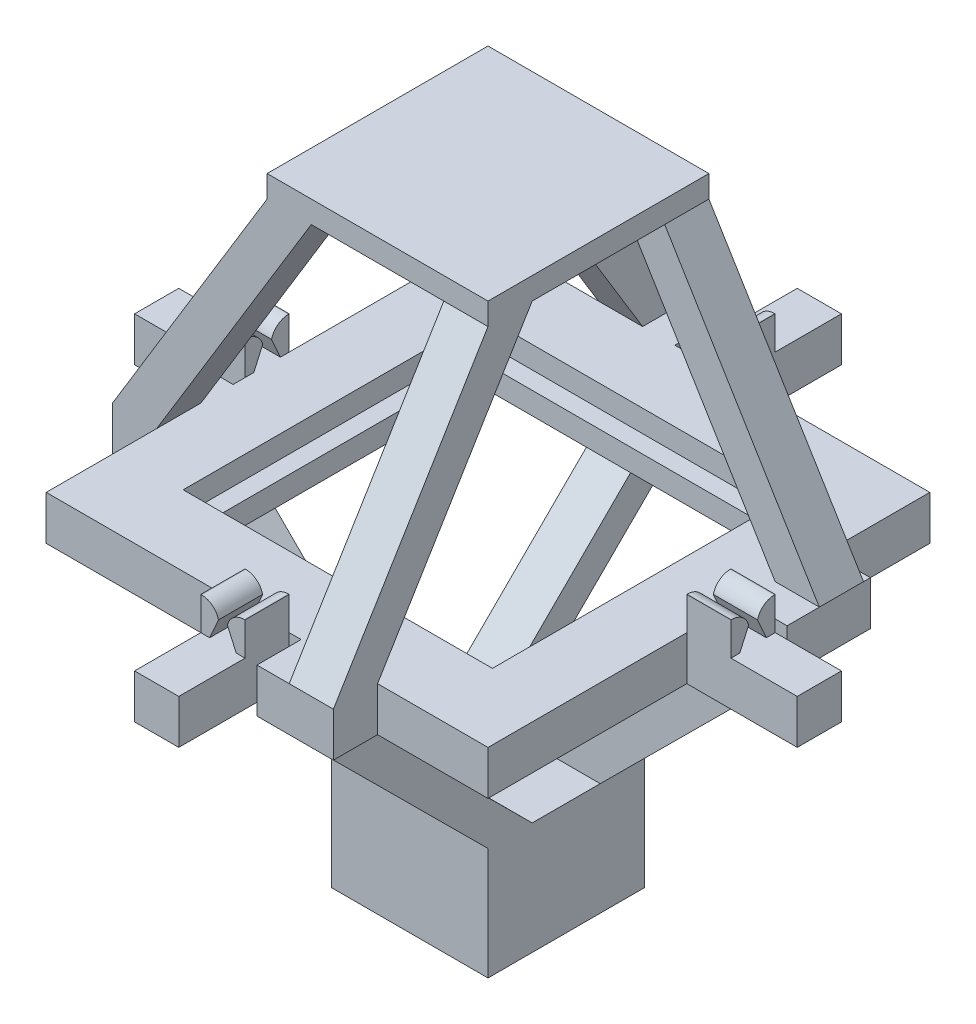
from build123d import *

# Parameters (mm, degrees)
SKETCH2_W            = 100
SKETCH2_H            = 100
BOSS_EXTRUDE1_DEPTH  = 5
SKETCH3_W            = 100
SKETCH3_H            = 100
BOSS_EXTRUDE2_DEPTH  = 5
SKETCH8_R            = 5
BOSS_EXTRUDE7_DEPTH  = 30
BOSS_EXTRUDE21_DEPTH = 10
FILLET14_R           = 4
FILLET13_R           = 4
SKETCH24_W           = 10
SKETCH24_H           = 10
BOSS_EXTRUDE22_DEPTH = 15
BOSS_EXTRUDE25_DEPTH = 10
SKETCH26_W           = 10
SKETCH26_H           = 10
BOSS_EXTRUDE26_DEPTH = 15
FILLET18_R           = 4
FILLET17_R           = 4
BOSS_EXTRUDE23_DEPTH = 10
SKETCH25_W           = 10
SKETCH25_H           = 10
BOSS_EXTRUDE24_DEPTH = 15
FILLET15_R           = 4
FILLET16_R           = 4
BOSS_EXTRUDE10_DEPTH = 10
FILLET19_R           = 4
SKETCH27_W           = 10
SKETCH27_H           = 10
BOSS_EXTRUDE27_DEPTH = 15
FILLET20_R           = 4
SKETCH62_R           = 11.223510807
CUT_EXTRUDE3_DEPTH   = 30
SKETCH64_W           = 35.4
SKETCH64_H           = 35.4
BOSS_EXTRUDE53_DEPTH = 25.4
SKETCH66_W           = 25.4
SKETCH66_H           = 25.4
CUT_EXTRUDE4_DEPTH   = 12.7
SKETCH67_W           = 50
SKETCH67_H           = 50
BOSS_EXTRUDE54_DEPTH = 5
SKETCH68_W           = 17.3
SKETCH68_H           = 10
BOSS_EXTRUDE55_DEPTH = 10
SKETCH69_W           = 17.3
SKETCH69_H           = 10
BOSS_EXTRUDE56_DEPTH = 10
SKETCH70_W           = 17.3
SKETCH70_H           = 10
BOSS_EXTRUDE57_DEPTH = 10
SKETCH74_W           = 17.3
SKETCH74_H           = 10
BOSS_EXTRUDE58_DEPTH = 10
BOSS_EXTRUDE59_DEPTH = 10
BOSS_EXTRUDE60_DEPTH = 10
BOSS_EXTRUDE61_DEPTH = 10
BOSS_EXTRUDE62_DEPTH = 10
BOSS_EXTRUDE63_DEPTH = 10
BOSS_EXTRUDE64_DEPTH = 10
SKETCH85_W           = 17.3
SKETCH85_H           = 10
BOSS_EXTRUDE65_DEPTH = 10
BOSS_EXTRUDE66_DEPTH = 10
BOSS_EXTRUDE67_DEPTH = 10
SKETCH90_W           = 70
SKETCH90_H           = 68
CUT_EXTRUDE5_DEPTH   = 5
SKETCH91_W           = 62
SKETCH91_H           = 60
CUT_EXTRUDE6_DEPTH   = 5


with BuildPart() as part:
    # Sketch2 → Boss-Extrude1 (new body)
    with BuildSketch(Plane(origin=(0, 0, 0), x_dir=(1, 0, 0), z_dir=(0, 1, 0))):
        Rectangle(SKETCH2_W, SKETCH2_H)
    extrude(amount=BOSS_EXTRUDE1_DEPTH)

    # Sketch3 → Boss-Extrude2 (add)
    with BuildSketch(Plane.XZ):
        Rectangle(SKETCH3_W, SKETCH3_H)
    extrude(amount=BOSS_EXTRUDE2_DEPTH)

    # Sketch8 → Boss-Extrude7 (add)
    with BuildSketch(Plane.XZ.offset(5)):
        with Locations(Location((0, 0, 0), (0, 0, 90))):
            Circle(SKETCH8_R)
    extrude(amount=BOSS_EXTRUDE7_DEPTH)

    # Sketch11 → Boss-Extrude21 (add)
    with BuildSketch(Plane(origin=(50, 0, 0), x_dir=(0, 0, -1), z_dir=(1, 0, 0))):
        Polygon((5, -5), (5, 12.5), (1, 12.5), (1, 9.5), (3, 5), (-3, 5), (-1, 9.5), (-1, 12.5), (-5, 12.5), (-5, -5), align=None)
    extrude(amount=BOSS_EXTRUDE21_DEPTH)

    # Fillet14
    # the kernel refuses this fillet: 4 mm, written as the material it takes off along each edge
    with BuildSketch(Plane(origin=(40.317541634, 12.5, -1), x_dir=(0, -1, 0), z_dir=(1, 0, 0))) as fillet14_piece_1:
        with BuildLine():
            CenterArc((4, 3.872983346), FILLET14_R, 180, 75.522487814)
            Line((0, 3.872983346), (-0.08, 3.872983346))
            Line((-0.08, 3.872983346), (-0.08, 0))
            Line((-0.08, 0), (0, -0.08))
            ThreePointArc((0, -0.08), (1.5, -0.08), (2.98, -0.077459667))
            Line((2.98, -0.077459667), (3, 0))
        make_face()
    extrude(amount=29.364916731, mode=Mode.SUBTRACT)

    # Fillet13
    # the kernel refuses this fillet: 4 mm, written as the material it takes off along each edge
    with BuildSketch(Plane(origin=(40.317541634, 12.5, 1), x_dir=(0, 0, 1), z_dir=(1, 0, 0))) as fillet13_piece_1:
        with BuildLine():
            CenterArc((3.872983346, 4), FILLET13_R, 194.477512186, 75.522487814)
            Line((0, 3), (-0.077459667, 2.98))
            ThreePointArc((-0.077459667, 2.98), (-0.08, 1.5), (-0.08, 0))
            Line((-0.08, 0), (0, -0.08))
            Line((0, -0.08), (3.872983346, -0.08))
            Line((3.872983346, -0.08), (3.872983346, 0))
        make_face()
    extrude(amount=29.364916731, mode=Mode.SUBTRACT)

    # Sketch24 → Boss-Extrude22 (add)
    with BuildSketch(Plane(origin=(60, 0, 0), x_dir=(0, 0, -1), z_dir=(1, 0, 0))):
        Rectangle(SKETCH24_W, SKETCH24_H)
    extrude(amount=BOSS_EXTRUDE22_DEPTH)

    # Sketch13 → Boss-Extrude25 (add)
    with BuildSketch(Plane.ZY.offset(50)):
        Polygon((-5, 12.5), (-5, -5), (5, -5), (5, 12.5), (1, 12.5), (1, 9.5), (3, 5), (-3, 5), (-1, 9.5), (-1, 12.5), align=None)
    extrude(amount=BOSS_EXTRUDE25_DEPTH)

    # Sketch26 → Boss-Extrude26 (add)
    with BuildSketch(Plane.ZY.offset(60)):
        Rectangle(SKETCH26_W, SKETCH26_H)
    extrude(amount=BOSS_EXTRUDE26_DEPTH)

    # Fillet18
    # the kernel refuses this fillet: 4 mm, written as the material it takes off along each edge
    with BuildSketch(Plane(origin=(-40.317541634, 12.5, 1), x_dir=(0, -1, 0), z_dir=(-1, 0, 0))) as fillet18_piece_1:
        with BuildLine():
            CenterArc((4, 3.872983346), FILLET18_R, 180, 75.522487814)
            Line((0, 3.872983346), (-0.08, 3.872983346))
            Line((-0.08, 3.872983346), (-0.08, 0))
            Line((-0.08, 0), (0, -0.08))
            ThreePointArc((0, -0.08), (1.5, -0.08), (2.98, -0.077459667))
            Line((2.98, -0.077459667), (3, 0))
        make_face()
    extrude(amount=29.364916731, mode=Mode.SUBTRACT)

    # Fillet17
    # the kernel refuses this fillet: 4 mm, written as the material it takes off along each edge
    with BuildSketch(Plane(origin=(-40.317541634, 12.5, -1), x_dir=(0, 0, -1), z_dir=(-1, 0, 0))) as fillet17_piece_1:
        with BuildLine():
            CenterArc((3.872983346, 4), FILLET17_R, 194.477512186, 75.522487814)
            Line((0, 3), (-0.077459667, 2.98))
            ThreePointArc((-0.077459667, 2.98), (-0.08, 1.5), (-0.08, 0))
            Line((-0.08, 0), (0, -0.08))
            Line((0, -0.08), (3.872983346, -0.08))
            Line((3.872983346, -0.08), (3.872983346, 0))
        make_face()
    extrude(amount=29.364916731, mode=Mode.SUBTRACT)

    # Sketch14 → Boss-Extrude23 (add)
    with BuildSketch(Plane(origin=(0, 0, -50), x_dir=(-1, 0, 0), z_dir=(0, 0, -1))):
        Polygon((-5, 12.5), (-1, 12.5), (-1, 9.5), (-3, 5), (3, 5), (1, 9.5), (1, 12.5), (5, 12.5), (5, -5), (-5, -5), align=None)
    extrude(amount=BOSS_EXTRUDE23_DEPTH)

    # Sketch25 → Boss-Extrude24 (add)
    with BuildSketch(Plane(origin=(0, 0, -60), x_dir=(-1, 0, 0), z_dir=(0, 0, -1))):
        Rectangle(SKETCH25_W, SKETCH25_H)
    extrude(amount=BOSS_EXTRUDE24_DEPTH)

    # Fillet15
    # the kernel refuses this fillet: 4 mm, written as the material it takes off along each edge
    with BuildSketch(Plane(origin=(-1, 12.5, -40.317541634), x_dir=(0, -1, 0), z_dir=(0, 0, -1))) as fillet15_piece_1:
        with BuildLine():
            CenterArc((4, 3.872983346), FILLET15_R, 180, 75.522487814)
            Line((0, 3.872983346), (-0.08, 3.872983346))
            Line((-0.08, 3.872983346), (-0.08, 0))
            Line((-0.08, 0), (0, -0.08))
            ThreePointArc((0, -0.08), (1.5, -0.08), (2.98, -0.077459667))
            Line((2.98, -0.077459667), (3, 0))
        make_face()
    extrude(amount=29.364916731, mode=Mode.SUBTRACT)

    # Fillet16
    # the kernel refuses this fillet: 4 mm, written as the material it takes off along each edge
    with BuildSketch(Plane(origin=(1, 12.5, -40.317541634), x_dir=(0, -1, 0), z_dir=(0, 0, -1))) as fillet16_piece_1:
        with BuildLine():
            CenterArc((4, -3.872983346), FILLET16_R, 104.477512186, 75.522487814)
            Line((0, -3.872983346), (-0.08, -3.872983346))
            Line((-0.08, -3.872983346), (-0.08, 0))
            Line((-0.08, 0), (0, 0.08))
            ThreePointArc((0, 0.08), (1.5, 0.08), (2.98, 0.077459667))
            Line((2.98, 0.077459667), (3, 0))
        make_face()
    extrude(amount=29.364916731, mode=Mode.SUBTRACT)

    # Sketch12 → Boss-Extrude10 (add)
    with BuildSketch(Plane.XY.offset(50)):
        Polygon((-5, 12.5), (-5, -5), (5, -5), (5, 12.5), (1, 12.5), (1, 9.5), (3, 5), (-3, 5), (-1, 9.5), (-1, 12.5), align=None)
    extrude(amount=BOSS_EXTRUDE10_DEPTH)

    # Fillet19
    # the kernel refuses this fillet: 4 mm, written as the material it takes off along each edge
    with BuildSketch(Plane(origin=(-1, 12.5, 40.317541634), x_dir=(-1, 0, 0), z_dir=(0, 0, 1))) as fillet19_piece_1:
        with BuildLine():
            CenterArc((3.872983346, 4), FILLET19_R, 194.477512186, 75.522487814)
            Line((0, 3), (-0.077459667, 2.98))
            ThreePointArc((-0.077459667, 2.98), (-0.08, 1.5), (-0.08, 0))
            Line((-0.08, 0), (0, -0.08))
            Line((0, -0.08), (3.872983346, -0.08))
            Line((3.872983346, -0.08), (3.872983346, 0))
        make_face()
    extrude(amount=29.364916731, mode=Mode.SUBTRACT)

    # Sketch27 → Boss-Extrude27 (add)
    with BuildSketch(Plane.XY.offset(60)):
        Rectangle(SKETCH27_W, SKETCH27_H)
    extrude(amount=BOSS_EXTRUDE27_DEPTH)

    # Fillet20
    # the kernel refuses this fillet: 4 mm, written as the material it takes off along each edge
    with BuildSketch(Plane(origin=(1, 12.5, 40.317541634), x_dir=(1, 0, 0), z_dir=(0, 0, 1))) as fillet20_piece_1:
        with BuildLine():
            CenterArc((3.872983346, -4), FILLET20_R, 90, 75.522487814)
            Line((0, -3), (-0.077459667, -2.98))
            ThreePointArc((-0.077459667, -2.98), (-0.08, -1.5), (-0.08, 0))
            Line((-0.08, 0), (0, 0.08))
            Line((0, 0.08), (3.872983346, 0.08))
            Line((3.872983346, 0.08), (3.872983346, 0))
        make_face()
    extrude(amount=29.364916731, mode=Mode.SUBTRACT)

    # Sketch62 → Cut-Extrude3 (cut)
    with BuildSketch(Plane.XZ.offset(5)):
        Circle(SKETCH62_R)
    extrude(amount=CUT_EXTRUDE3_DEPTH, mode=Mode.SUBTRACT)

    # Sketch68 → Boss-Extrude55 (add)
    with BuildSketch(Plane.XY.offset(50)):
        with Locations((16.35, 0)):
            Rectangle(SKETCH68_W, SKETCH68_H)
    extrude(amount=BOSS_EXTRUDE55_DEPTH)

    # Sketch69 → Boss-Extrude56 (add)
    with BuildSketch(Plane(origin=(50, 0, 0), x_dir=(0, 0, -1), z_dir=(1, 0, 0))):
        with Locations((17.90253263, 0)):
            Rectangle(SKETCH69_W, SKETCH69_H)
    extrude(amount=BOSS_EXTRUDE56_DEPTH)

    # Sketch70 → Boss-Extrude57 (add)
    with BuildSketch(Plane(origin=(0, 0, -50), x_dir=(-1, 0, 0), z_dir=(0, 0, -1))):
        with Locations((16.35, 0)):
            Rectangle(SKETCH70_W, SKETCH70_H)
    extrude(amount=BOSS_EXTRUDE57_DEPTH)

    # Sketch74 → Boss-Extrude58 (add)
    with BuildSketch(Plane.ZY.offset(50)):
        with Locations((16.35, 0)):
            Rectangle(SKETCH74_W, SKETCH74_H)
    extrude(amount=BOSS_EXTRUDE58_DEPTH)



with BuildPart() as body_2:
    # Sketch64 → Boss-Extrude53 (new body)
    with BuildSketch(Plane(origin=(0, -72.5, 0), x_dir=(1, 0, 0), z_dir=(0, 1, 0))):
        Rectangle(SKETCH64_W, SKETCH64_H)
    extrude(amount=BOSS_EXTRUDE53_DEPTH)

    # Sketch66 → Cut-Extrude4 (cut)
    with BuildSketch(Plane(origin=(0, -72.5, 0), x_dir=(-1, 0, 0), z_dir=(0, -1, 0))):
        Rectangle(SKETCH66_W, SKETCH66_H)
    extrude(amount=-CUT_EXTRUDE4_DEPTH, mode=Mode.SUBTRACT)


with BuildPart() as body_3:
    # Sketch67 → Boss-Extrude54 (new body)
    with BuildSketch(Plane(origin=(0, 67.5, 0), x_dir=(1, 0, 0), z_dir=(0, 1, 0))):
        Rectangle(SKETCH67_W, SKETCH67_H)
    extrude(amount=-BOSS_EXTRUDE54_DEPTH)


with BuildPart() as part_1:
    add(part.part)

    add(body_2.part)  # Boss-Extrude59 merges body 2
    # Sketch76 → Boss-Extrude59 (add)
    with BuildSketch(Plane.ZY.offset(17.7)):
        Polygon((-17.7, -47.1), (-60, -5), (-50, -5), (-7.7, -47.1), align=None)
    extrude(amount=-BOSS_EXTRUDE59_DEPTH)


    add(body_3.part)  # Boss-Extrude60 merges body 3
    # Sketch77 → Boss-Extrude60 (add)
    with BuildSketch(Plane.ZY.offset(25)):
        Polygon((-25, 62.5), (-60, 5), (-50, 5), (-15, 62.5), align=None)
    extrude(amount=-BOSS_EXTRUDE60_DEPTH)

    # Sketch78 → Boss-Extrude61 (add)
    with BuildSketch(Plane.XY.offset(17.7)):
        Polygon((-17.7, -47.1), (-60, -5), (-50, -5), (-7.7, -47.1), align=None)
    extrude(amount=-BOSS_EXTRUDE61_DEPTH)

    # Sketch79 → Boss-Extrude62 (add)
    with BuildSketch(Plane.XY.offset(25)):
        Polygon((-25, 62.5), (-60, 5), (-50, 5), (-15, 62.5), align=None)
    extrude(amount=-BOSS_EXTRUDE62_DEPTH)

    # Sketch82 → Boss-Extrude63 (add)
    with BuildSketch(Plane(origin=(17.7, 0, 0), x_dir=(0, 0, -1), z_dir=(1, 0, 0))):
        Polygon((-60, -5), (-17.7, -47.1), (-7.7, -47.1), (-50, -5), align=None)
    extrude(amount=-BOSS_EXTRUDE63_DEPTH)

    # Sketch83 → Boss-Extrude64 (add)
    with BuildSketch(Plane(origin=(25, 0, 0), x_dir=(0, 0, -1), z_dir=(1, 0, 0))):
        Polygon((-25, 62.5), (-60, 5), (-50, 5), (-15, 62.5), align=None)
    extrude(amount=-BOSS_EXTRUDE64_DEPTH)

    # Sketch85 → Boss-Extrude65 (add)
    with BuildSketch(Plane(origin=(50, 0, 0), x_dir=(0, 0, -1), z_dir=(1, 0, 0))):
        with Locations((16.35, 0)):
            Rectangle(SKETCH85_W, SKETCH85_H)
    extrude(amount=BOSS_EXTRUDE65_DEPTH)

    # Sketch86 → Boss-Extrude66 (add)
    with BuildSketch(Plane(origin=(0, 0, -25), x_dir=(-1, 0, 0), z_dir=(0, 0, -1))):
        Polygon((-25, 62.5), (-60, 5), (-50, 5), (-15, 62.5), align=None)
    extrude(amount=-BOSS_EXTRUDE66_DEPTH)

    # Sketch89 → Boss-Extrude67 (add)
    with BuildSketch(Plane(origin=(0, 0, -17.7), x_dir=(-1, 0, 0), z_dir=(0, 0, -1))):
        Polygon((-60, -5), (-50, -5), (-7.7, -47.1), (-17.7, -47.1), align=None)
    extrude(amount=-BOSS_EXTRUDE67_DEPTH)

    # Sketch90 → Cut-Extrude5 (cut)
    with BuildSketch(Plane(origin=(0, 5, 0), x_dir=(1, 0, 0), z_dir=(0, 1, 0))):
        Rectangle(SKETCH90_W, SKETCH90_H)
    extrude(amount=-CUT_EXTRUDE5_DEPTH, mode=Mode.SUBTRACT)

    # Sketch91 → Cut-Extrude6 (cut)
    with BuildSketch(Plane(origin=(0, 0, 0), x_dir=(1, 0, 0), z_dir=(0, 1, 0))):
        Rectangle(SKETCH91_W, SKETCH91_H)
    extrude(amount=-CUT_EXTRUDE6_DEPTH, mode=Mode.SUBTRACT)


solid = part_1.part
